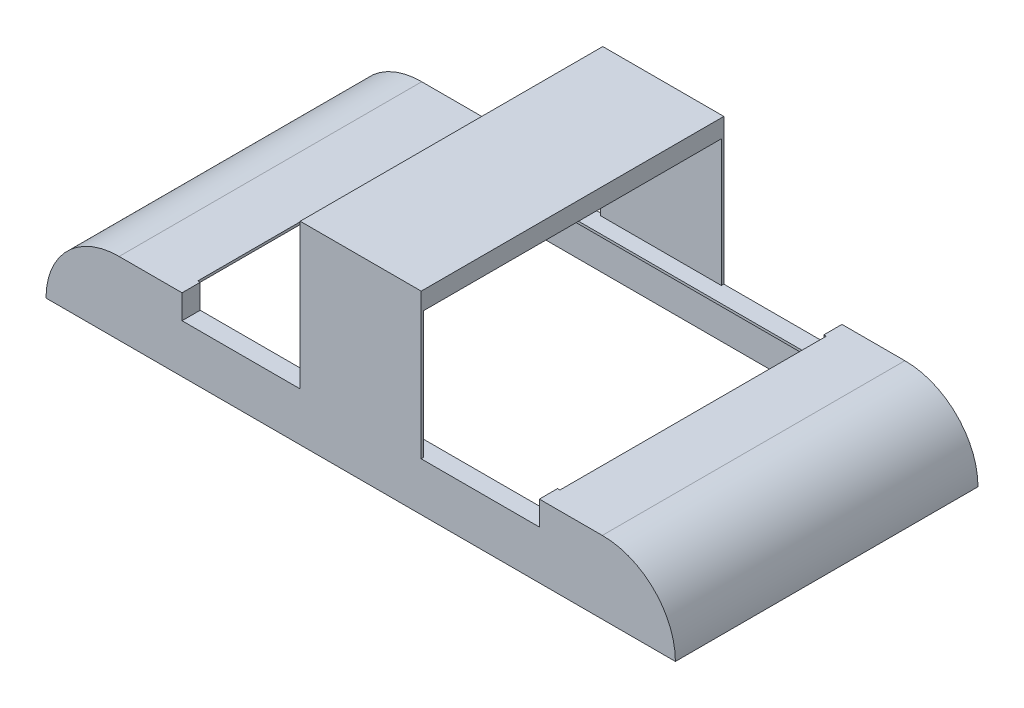
from build123d import *

# Parameters (mm, degrees)
BOSS_EXTRUDE1_DEPTH = 250
SKETCH2_W           = 299.205309142
SKETCH2_H           = 220
CUT_EXTRUDE1_DEPTH  = 581.086200491
SKETCH4_W           = 299.205309142
SKETCH4_H           = 15
CUT_EXTRUDE2_DEPTH  = 20
SHELL1_START        = 2
SHELL1_DEPTH        = 246
SKETCH5_W           = 15
SKETCH5_H           = 20
BOSS_EXTRUDE2_DEPTH = 2
SKETCH6_W           = 15
SKETCH6_H           = 20
BOSS_EXTRUDE3_DEPTH = 2
SKETCH7_W           = 100
SKETCH7_H           = 120
BOSS_EXTRUDE4_DEPTH = 250
CUT_EXTRUDE3_DEPTH  = 100


# Read off the part's stored shape, not the designer's step: Shell1
with BuildPart() as part:
    # Sketch1 → Boss-Extrude1 (new body)
    with BuildSketch(Plane.XY):
        with BuildLine():
            Line((0, 0), (520, 0))
            ThreePointArc((520, 0), (502.285771516, 42.567121511), (459.602654571, 60))
            Line((459.602654571, 60), (60.397345429, 60))
            ThreePointArc((60.397345429, 60), (17.714228484, 42.567121511), (0, 0))
        make_face()
    extrude(amount=BOSS_EXTRUDE1_DEPTH)

    # Sketch2 → Cut-Extrude1 (cut, through all)
    with BuildSketch(Plane(origin=(0, 60, 0), x_dir=(1, 0, 0), z_dir=(0, 1, 0))):
        with Locations((260, -125)):
            Rectangle(SKETCH2_W, SKETCH2_H)
    extrude(amount=-CUT_EXTRUDE1_DEPTH, mode=Mode.SUBTRACT)

    # Sketch4 → Cut-Extrude2 (cut)
    with BuildSketch(Plane(origin=(0, 60, 0), x_dir=(1, 0, 0), z_dir=(0, 1, 0))):
        with Locations((260, -242.5)):
            Rectangle(SKETCH4_W, SKETCH4_H)
        with Locations((260, -7.5)):
            Rectangle(SKETCH4_W, SKETCH4_H)
    extrude(amount=-CUT_EXTRUDE2_DEPTH, mode=Mode.SUBTRACT)

    # Shell1 outline → Shell1 (cut)
    with BuildSketch(Plane.XY.offset(SHELL1_START)):
        with BuildLine():
            Line((110.397345429, 38), (110.397345429, 58))
            Line((110.397345429, 58), (60.390688921, 58))
            ThreePointArc((60.390688921, 58), (19.126088629, 41.15055453), (2, 0))
            Line((2, 0), (518, 0))
            ThreePointArc((518, 0), (500.873911371, 41.15055453), (459.609311079, 58))
            Line((459.609311079, 58), (409.602654571, 58))
            Line((409.602654571, 58), (409.602654571, 38))
            Line((409.602654571, 38), (110.397345429, 38))
        make_face()
    extrude(amount=SHELL1_DEPTH, mode=Mode.SUBTRACT)

    # Sketch5 → Boss-Extrude2 (add)
    with BuildSketch(Plane.ZY.offset(-409.602654571)):
        with Locations((7.5, 50)):
            Rectangle(SKETCH5_W, SKETCH5_H)
        with Locations((242.5, 50)):
            Rectangle(SKETCH5_W, SKETCH5_H)
    extrude(amount=BOSS_EXTRUDE2_DEPTH)

    # Sketch6 → Boss-Extrude3 (add)
    with BuildSketch(Plane(origin=(110.397345429, 0, 0), x_dir=(0, 0, -1), z_dir=(1, 0, 0))):
        with Locations((-242.5, 50)):
            Rectangle(SKETCH6_W, SKETCH6_H)
        with Locations((-7.5, 50)):
            Rectangle(SKETCH6_W, SKETCH6_H)
    extrude(amount=BOSS_EXTRUDE3_DEPTH)

    # Sketch7 → Boss-Extrude4 (add)
    with BuildSketch(Plane.XY.offset(250)):
        with Locations((260, 100)):
            Rectangle(SKETCH7_W, SKETCH7_H)
    extrude(amount=-BOSS_EXTRUDE4_DEPTH)

    # Sketch8 → Cut-Extrude3 (cut)
    with BuildSketch(Plane(origin=(310, 0, 0), x_dir=(0, 0, -1), z_dir=(1, 0, 0))):
        Polygon((-248, 145), (-2, 145), (-2, 40), (-15, 40), (-235, 40), (-248, 40), align=None)
    extrude(amount=-CUT_EXTRUDE3_DEPTH, mode=Mode.SUBTRACT)


solid = part.part
